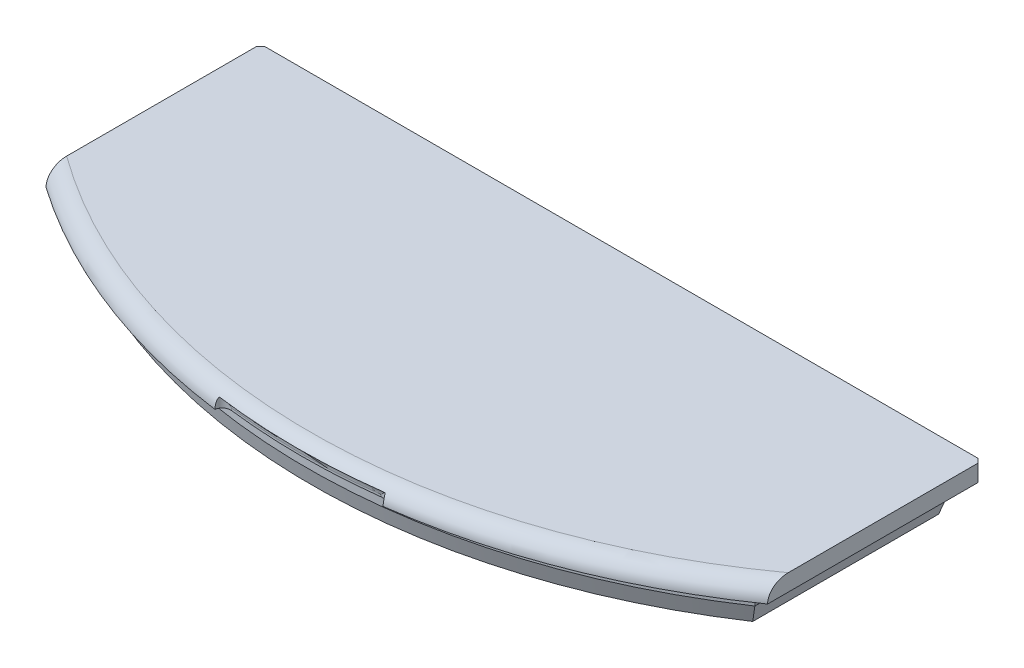
from build123d import *
from OCP.BRepFilletAPI import BRepFilletAPI_MakeChamfer

# Parameters (mm, degrees)
EXTRUDE_1_DEPTH     = 4
CHAMFER_1_SIZE      = 1
EXTRUDE_2_DEPTH     = 7
CHAMFER_2_SIZE      = 4
CHAMFER_2_SIZE2     = 1.07179677
CUT_EXTRUDE_1_DEPTH = 2.5
FILLET_1_R          = 2
FILLET_2_R          = 4


with BuildPart() as part:
    # 스케치1 → 보스-돌출1 (new body)
    with BuildSketch(Plane(origin=(0, 0, 0), x_dir=(1, 0, 0), z_dir=(0, 1, 0))):
        with BuildLine():
            Line((85.8, -72), (85.8, -123.038042897))
            ThreePointArc((85.8, -123.038042897), (0, -150), (-85.8, -123.038042897))
            Line((-85.8, -123.038042897), (-85.8, -72))
            Line((-85.8, -72), (85.8, -72))
        make_face()
    extrude(amount=EXTRUDE_1_DEPTH)

    # 모따기1
    chamfer_1_edges = [part.edges().sort_by_distance(p)[0] for p in [
        (85.8, 2, 72),
        (-85.8, 2, 72),
    ]]
    chamfer(chamfer_1_edges, length=CHAMFER_1_SIZE)

    # 스케치2 → 보스-돌출2 (add)
    with BuildSketch(Plane.XZ):
        with BuildLine():
            Line((-81.7, 76.1), (-81.7, 121.964544028))
            ThreePointArc((-81.7, 121.964544028), (0, 146.8), (81.7, 121.964544028))
            Line((81.7, 121.964544028), (81.7, 76.1))
            Line((81.7, 76.1), (-81.7, 76.1))
        make_face()
        with BuildLine():
            Line((-77.8, 80), (-77.8, 119.745563592))
            ThreePointArc((-77.8, 119.745563592), (0, 142.8), (77.8, 119.745563592))
            Line((77.8, 119.745563592), (77.8, 80))
            Line((77.8, 80), (-77.8, 80))
        make_face(mode=Mode.SUBTRACT)
    extrude(amount=EXTRUDE_2_DEPTH)

    # 모따기2: one chamfer whose edges measure the first distance from different faces: ONE call of the kernel's chamfer builder (chamfer() names one face for all edges)
    chamfer_2_edges_1 = [part.edges().sort_by_distance(p)[0] for p in [
        (0, -7, 146.8),
    ]]
    chamfer_2_side_1 = [part.faces().sort_by_distance(p)[0] for p in [
        (0, -3.5, 146.8),
    ]]
    chamfer_2_edges_2 = [part.edges().sort_by_distance(p)[0] for p in [
        (-81.7, -7, 99.032272014),
    ]]
    chamfer_2_side_2 = [part.faces().sort_by_distance(p)[0] for p in [
        (-81.7, -3.5, 99.032272014),
    ]]
    chamfer_2_edges_3 = [part.edges().sort_by_distance(p)[0] for p in [
        (0, -7, 76.1),
    ]]
    chamfer_2_side_3 = [part.faces().sort_by_distance(p)[0] for p in [
        (0, -3.5, 76.1),
    ]]
    chamfer_2_edges_4 = [part.edges().sort_by_distance(p)[0] for p in [
        (81.7, -7, 99.032272014),
    ]]
    chamfer_2_side_4 = [part.faces().sort_by_distance(p)[0] for p in [
        (81.7, -3.5, 99.032272014),
    ]]
    chamfer_2 = BRepFilletAPI_MakeChamfer(part.part.solid().wrapped)
    for e in chamfer_2_edges_1:
        chamfer_2.Add(CHAMFER_2_SIZE, CHAMFER_2_SIZE2, e.wrapped, chamfer_2_side_1[0].wrapped)  # the first distance lies on this face
    for e in chamfer_2_edges_2:
        chamfer_2.Add(CHAMFER_2_SIZE, CHAMFER_2_SIZE2, e.wrapped, chamfer_2_side_2[0].wrapped)  # the first distance lies on this face
    for e in chamfer_2_edges_3:
        chamfer_2.Add(CHAMFER_2_SIZE, CHAMFER_2_SIZE2, e.wrapped, chamfer_2_side_3[0].wrapped)  # the first distance lies on this face
    for e in chamfer_2_edges_4:
        chamfer_2.Add(CHAMFER_2_SIZE, CHAMFER_2_SIZE2, e.wrapped, chamfer_2_side_4[0].wrapped)  # the first distance lies on this face
    add(Compound.cast(chamfer_2.Shape()), mode=Mode.REPLACE)

    # 스케치3 → 컷-돌출1 (cut)
    with BuildSketch(Plane.XZ):
        with BuildLine():
            Line((20, 146.642422239), (20, 148.660687473))
            ThreePointArc((20, 148.660687473), (0, 150), (-20, 148.660687473))
            Line((-20, 148.660687473), (-20, 146.642422239))
            ThreePointArc((-20, 146.642422239), (0, 148), (20, 146.642422239))
        make_face()
    extrude(amount=-CUT_EXTRUDE_1_DEPTH, mode=Mode.SUBTRACT)

    # 필렛1
    # the kernel refuses this fillet: 2 mm, written as the material it adds along each edge
    with BuildSketch(Plane(origin=(20, 0, 146.642422239), x_dir=(-0.991822496989378, 0, 0.12762497586975344), z_dir=(0, 1, 0))) as fillet_1_piece_1:
        with BuildLine():
            CenterArc((2.257580225, 1.999942607), FILLET_1_R, 179.947910746, 89.618025307)
            Line((0.257581052, 2.001760865), (0.217581068, 2.00179723))
            ThreePointArc((0.217581068, 2.00179723), (0.089117626, 1.005985431), (-0.0396729, 0.005104999))
            Line((-0.0396729, 0.005104999), (0.000303031, -0.039998852))
            ThreePointArc((0.000303031, -0.039998852), (1.12121434, -0.035752907), (2.242125649, -0.039998852))
            Line((2.242125649, -0.039998852), (2.24242868, 0))
        make_face()
    extrude(amount=2.5)
    with BuildSketch(Plane(origin=(-20, 0, 146.642422239), x_dir=(0, 0, 1), z_dir=(0, 1, 0))) as fillet_1_piece_2:
        with BuildLine():
            CenterArc((2.271711692, 1.983876229), FILLET_1_R, 173.101693725, 89.618025307)
            Line((0.286189906, 2.224091213), (0.24647947, 2.228895513))
            ThreePointArc((0.24647947, 2.228895513), (0.107634416, 1.11660857), (-0.039633087, 0.005405405))
            Line((-0.039633087, 0.005405405), (0, -0.04))
            ThreePointArc((0, -0.04), (1.009132617, -0.04), (2.013196305, -0.039677525))
            Line((2.013196305, -0.039677525), (2.018265235, 0))
        make_face()
    extrude(amount=2.5)
    with BuildSketch(Plane(origin=(0, 2.5, 0), x_dir=(-0.16852594692662803, 0, 0.9856972178171568), z_dir=(-0.9856972178171568, 0, -0.16852594692662803))) as fillet_1_piece_3:
        with BuildLine():
            CenterArc((148 + FILLET_1_R, -FILLET_1_R), FILLET_1_R, 90, 90)
            Line((148 + FILLET_1_R, 0), (148 + FILLET_1_R, FILLET_1_R * 0.02))
            Line((148 + FILLET_1_R, FILLET_1_R * 0.02), (148 - FILLET_1_R * 0.02, FILLET_1_R * 0.02))
            Line((148 - FILLET_1_R * 0.02, FILLET_1_R * 0.02), (148 - FILLET_1_R * 0.02, -FILLET_1_R))
            Line((148 - FILLET_1_R * 0.02, -FILLET_1_R), (148, -FILLET_1_R))
        make_face()
    revolve(axis=Axis((0, 2.5, 0), (0, 1, 0)), revolution_arc=19.4042511)

    # 필렛2
    # the kernel refuses this fillet: 4 mm, written as the material it takes off along each edge
    with BuildSketch(Plane(origin=(0, 4, 0), x_dir=(0.6253849976440692, 0, 0.7803163491313813), z_dir=(0.7803163491313813, 0, -0.6253849976440692))) as fillet_2_piece_1_section:
        with BuildLine():
            CenterArc((150 - FILLET_2_R, FILLET_2_R), FILLET_2_R, 270, 90)
            Line((150 - FILLET_2_R, 0), (150 - FILLET_2_R, -FILLET_2_R * 0.02))
            Line((150 - FILLET_2_R, -FILLET_2_R * 0.02), (150 + FILLET_2_R * 0.02, -FILLET_2_R * 0.02))
            Line((150 + FILLET_2_R * 0.02, -FILLET_2_R * 0.02), (150 + FILLET_2_R * 0.02, FILLET_2_R))
            Line((150 + FILLET_2_R * 0.02, FILLET_2_R), (150, FILLET_2_R))
        make_face()
    fillet_2_piece_1 = revolve(axis=Axis((0, 4, 0), (0, -1, 0)), revolution_arc=77.420901677, mode=Mode.PRIVATE)
    fillet_2_piece_1 = split(fillet_2_piece_1, bisect_by=Plane(origin=(85.8, 2.892558324, 148.892558324), z_dir=(-1, 0, 0)), keep=Keep.TOP, mode=Mode.PRIVATE)
    fillet_2_piece_1 = split(fillet_2_piece_1, bisect_by=Plane(origin=(-85.8, 2.892558324, 148.892558324), z_dir=(1, 0, 0)), keep=Keep.TOP, mode=Mode.PRIVATE)
    add(fillet_2_piece_1, mode=Mode.SUBTRACT)


solid = part.part
